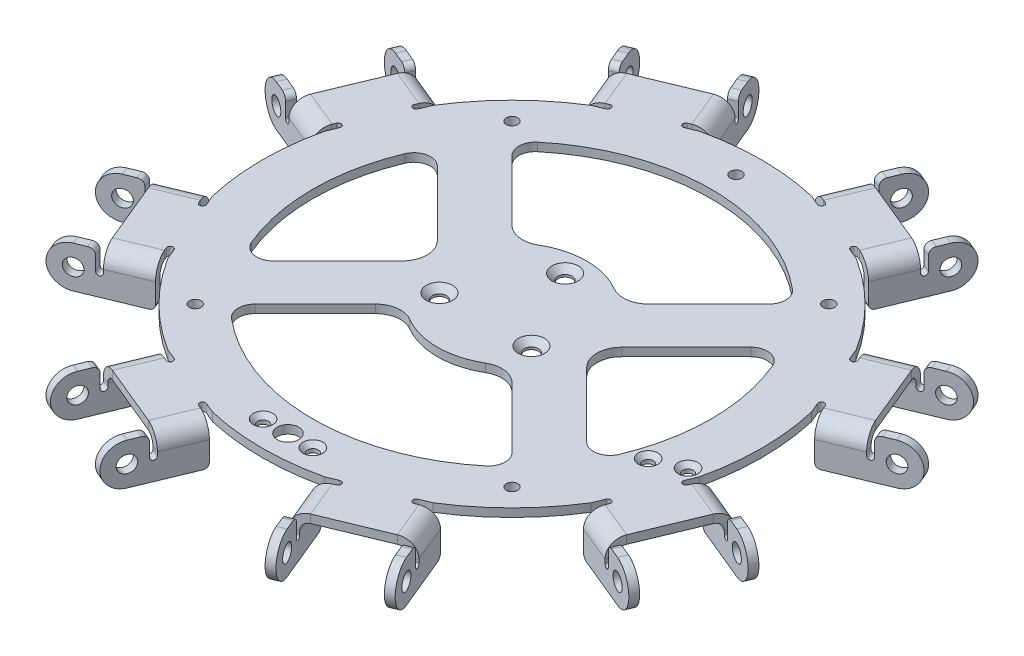
from build123d import *

# Parameters (mm, degrees)
BASIS_BLECH1_START              = -2.5
BASIS_BLECH1_DEPTH              = 2.5
KANTE_LASCHE2_START             = 76
KANTE_LASCHE2_DEPTH             = 12
KANTE_LASCHE2_START_2           = 74.18894796
KANTE_LASCHE2_2_DEPTH           = 13.81105204
KANTE_LASCHE2_START_3           = -2.5
KANTE_LASCHE2_3_DEPTH           = 2.5
VERRUNDUNG4_R                   = 1.5
SKIZZE34_R                      = 2.5
AUFSATZ_LINEAR_AUSTRAGEN2_DEPTH = 2.5
VERRUNDUNG4_OF_SPIEGELN2_R      = 1.5
KREISMUSTER5_COUNT              = 8
SKIZZE51_R                      = 2.15
ZUNGE1_DEPTH                    = 2.5
VERRUNDUNG3_R                   = 5
FASE1_SIZE                      = 1.8
SKIZZE52_R                      = 1.75
SKIZZE52_R_2                    = 3.25
SKIZZE52_R_3                    = 1.6
SCHNITT_LINEAR_AUSTRAGEN1_DEPTH = 141.962759918
FASE2_SIZE                      = 1.35


# Read off the part's stored shape, not the designer's step: Basis-Blech1, Kante-Lasche2
# Sheet-metal steps are written as plain solids
with BuildPart() as part:
    # Basis-Blech1 outline → Basis-Blech1 (new body)
    with BuildSketch(Plane(origin=(0, 0, 0), x_dir=(1, 0, 0), z_dir=(0, 1, 0)).offset(BASIS_BLECH1_START)):
        with BuildLine():
            ThreePointArc((17.535446703, 74.998387375), (18.025513853, 73.815260616), (16.842387094, 73.325193467))
            ThreePointArc((16.842387094, 73.325193467), (8.475139561, 74.755749006), (0, 75.234632982))
            Line((0, 75.234632982), (0, 60))
            ThreePointArc((0, 60), (22.961005942, 55.432771951), (42.426406871, 42.426406871))
            Line((42.426406871, 42.426406871), (53.198919162, 53.198919162))
            ThreePointArc((53.198919162, 53.198919162), (46.8674684, 58.85312571), (39.939375407, 63.758107658))
            ThreePointArc((39.939375407, 63.758107658), (39.449308257, 64.941234417), (40.632435016, 65.431301566))
            Line((40.632435016, 65.431301566), (45.224636205, 76.517855956))
            Line((45.224636205, 76.517855956), (22.127647892, 86.084941766))
            Line((22.127647892, 86.084941766), (17.535446703, 74.998387375))
        make_face()
    extrude(amount=BASIS_BLECH1_DEPTH)

    # Kante-Lasche2 outline → Kante-Lasche2 (add)
    with BuildSketch(Plane(origin=(0, 0, 0), x_dir=(0.9238795325112853, 0, 0.38268343236509317), z_dir=(0.38268343236509317, 0, -0.9238795325112854)).offset(KANTE_LASCHE2_START)):
        with BuildLine():
            Line((-15, 12.5), (-15, 5))
            ThreePointArc((-15, 5), (-14.330127019, 2.5), (-12.5, 0.669872981))
            Line((-12.5, 0.669872981), (-12.5, 2.5))
            Line((-12.5, 2.5), (-10, 2.5))
            ThreePointArc((-10, 2.5), (-11.767766953, 3.232233047), (-12.5, 5))
            Line((-12.5, 5), (-12.5, 12.5))
            Line((-12.5, 12.5), (-15, 12.5))
        make_face()
    kante_lasche2 = extrude(amount=KANTE_LASCHE2_DEPTH)

    # Kante-Lasche2 2 outline → Kante-Lasche2 2 (cut)
    with BuildSketch(Plane(origin=(0, 0, 0), x_dir=(0.9238795325112853, 0, 0.38268343236509317), z_dir=(0.38268343236509317, 0, -0.9238795325112854)).offset(KANTE_LASCHE2_START_2)):
        with BuildLine():
            ThreePointArc((-10, 0), (-11.294095226, 0.170370868), (-12.5, 0.669872981))
            Line((-12.5, 0.669872981), (-12.5, 0))
            Line((-12.5, 0), (-10, 0))
        make_face()
    kante_lasche2_2 = extrude(amount=KANTE_LASCHE2_2_DEPTH, mode=Mode.SUBTRACT)

    # Kante-Lasche2 3 outline → Kante-Lasche2 3 (cut)
    with BuildSketch(Plane(origin=(0, 0, 0), x_dir=(1, 0, 0), z_dir=(0, 1, 0)).offset(KANTE_LASCHE2_START_3)):
        with BuildLine():
            Line((20.769025067, 73.658995362), (19.845145535, 74.041678795))
            Line((19.845145535, 74.041678795), (17.535446703, 74.998387375))
            ThreePointArc((17.535446703, 74.998387375), (18.025513853, 73.815260616), (16.842387094, 73.325193467))
            Line((16.842387094, 73.325193467), (20.075965456, 71.98580145))
            ThreePointArc((20.075965456, 71.98580145), (21.259092218, 72.4758686), (20.769025067, 73.658995362))
        make_face()
    kante_lasche2_3 = extrude(amount=KANTE_LASCHE2_3_DEPTH, mode=Mode.SUBTRACT)

    # Verrundung4
    verrundung4_edges = [part.edges().sort_by_distance(p)[0] for p in [
        (16.380597288, -12.5, -75.476741666),
    ]]
    fillet(verrundung4_edges, radius=VERRUNDUNG4_R)

    # Skizze34 → Aufsatz-Linear austragen2 (add)
    with BuildSketch(Plane(origin=(-13.858192988, 0, -5.740251485), x_dir=(0.38268343236509406, -1.369350941250924e-15, -0.9238795325112851), z_dir=(0.923879532511285, -3.3059056140163063e-15, 0.382683432365094))):
        with BuildLine():
            Line((89.81105204, -5), (89.81105204, -6))
            ThreePointArc((89.81105204, -6), (88.90552602, -6.90552602), (88, -6))
            Line((88, -6), (88, -12.5))
            Line((88, -12.5), (95, -12.5))
            ThreePointArc((95, -12.5), (101.25, -6.25), (95, 0))
            Line((95, 0), (91.62105204, 0))
            ThreePointArc((91.62105204, 0), (90.341188766, -0.530136726), (89.81105204, -1.81))
            Line((89.81105204, -1.81), (89.81105204, -5))
        make_face()
        with Locations((95, -6.25)):
            Circle(SKIZZE34_R, mode=Mode.SUBTRACT)
    aufsatz_linear_austragen2 = extrude(amount=AUFSATZ_LINEAR_AUSTRAGEN2_DEPTH)

    # Spiegeln2: Kante-Lasche2, Kante-Lasche2 2, Kante-Lasche2 3, Aufsatz-Linear austragen2 across plane
    add(kante_lasche2.mirror(Plane(origin=(0, 0, 0), x_dir=(-0.38268343236509167, 0, 0.923879532511286), z_dir=(0.923879532511286, 0, 0.38268343236509167))))
    add(kante_lasche2_2.mirror(Plane(origin=(0, 0, 0), x_dir=(-0.38268343236509167, 0, 0.923879532511286), z_dir=(0.923879532511286, 0, 0.38268343236509167))), mode=Mode.SUBTRACT)
    add(kante_lasche2_3.mirror(Plane(origin=(0, 0, 0), x_dir=(-0.38268343236509167, 0, 0.923879532511286), z_dir=(0.923879532511286, 0, 0.38268343236509167))), mode=Mode.SUBTRACT)
    add(aufsatz_linear_austragen2.mirror(Plane(origin=(0, 0, 0), x_dir=(-0.38268343236509167, 0, 0.923879532511286), z_dir=(0.923879532511286, 0, 0.38268343236509167))))

    # Verrundung4 of Spiegeln2
    verrundung4_of_spiegeln2_edges = [part.edges().sort_by_distance(p)[0] for p in [
        (41.787284432, -12.5, -64.952947276),
    ]]
    fillet(verrundung4_of_spiegeln2_edges, radius=VERRUNDUNG4_OF_SPIEGELN2_R)


with BuildPart() as kreismuster5_1:
    # Kreismuster5: pattern copy
    add(part.part.rotate(Axis((0, 0, 0), (0, 1, 0)), 1 * 360 / KREISMUSTER5_COUNT))


with BuildPart() as kreismuster5_2:
    # Kreismuster5: pattern copy
    add(part.part.rotate(Axis((0, 0, 0), (0, 1, 0)), 2 * 360 / KREISMUSTER5_COUNT))


with BuildPart() as kreismuster5_3:
    # Kreismuster5: pattern copy
    add(part.part.rotate(Axis((0, 0, 0), (0, 1, 0)), 3 * 360 / KREISMUSTER5_COUNT))


with BuildPart() as kreismuster5_4:
    # Kreismuster5: pattern copy
    add(part.part.rotate(Axis((0, 0, 0), (0, 1, 0)), 4 * 360 / KREISMUSTER5_COUNT))


with BuildPart() as kreismuster5_5:
    # Kreismuster5: pattern copy
    add(part.part.rotate(Axis((0, 0, 0), (0, 1, 0)), 5 * 360 / KREISMUSTER5_COUNT))


with BuildPart() as kreismuster5_6:
    # Kreismuster5: pattern copy
    add(part.part.rotate(Axis((0, 0, 0), (0, 1, 0)), 6 * 360 / KREISMUSTER5_COUNT))


with BuildPart() as kreismuster5_7:
    # Kreismuster5: pattern copy
    add(part.part.rotate(Axis((0, 0, 0), (0, 1, 0)), 7 * 360 / KREISMUSTER5_COUNT))


with BuildPart() as kreismuster5_2_1:
    add(kreismuster5_2.part)

    # Kombinieren1: union Kreismuster5_6, Kreismuster5_1, Kreismuster5_5, Kreismuster5_4, part, Kreismuster5_3, Kreismuster5_7
    add(kreismuster5_6.part)
    add(kreismuster5_1.part)
    add(kreismuster5_5.part)
    add(kreismuster5_4.part)
    add(part.part)
    add(kreismuster5_3.part)
    add(kreismuster5_7.part)

    # Skizze51 → Zunge1 (add)
    with BuildSketch(Plane(origin=(0, 0, 0), x_dir=(1, 0, 0), z_dir=(0, 1, 0))):
        with BuildLine():
            Line((-20.539595906, 20.539595906), (-42.426406871, 42.426406871))
            ThreePointArc((-42.426406871, 42.426406871), (-47.721033909, 36.368982976), (-52.15767043, 29.65767043))
            Line((-52.15767043, 29.65767043), (-27.803300859, 5.303300859))
            ThreePointArc((-27.803300859, 5.303300859), (-25.606601718, 0), (-27.803300859, -5.303300859))
            Line((-27.803300859, -5.303300859), (-52.15767043, -29.65767043))
            ThreePointArc((-52.15767043, -29.65767043), (-47.721033909, -36.368982976), (-42.426406871, -42.426406871))
            Line((-42.426406871, -42.426406871), (-20.539595906, -20.539595906))
            ThreePointArc((-20.539595906, -20.539595906), (-16.181327241, -18.402674043), (-11.427221286, -19.382172574))
            ThreePointArc((-11.427221286, -19.382172574), (0, -22.5), (11.427221286, -19.382172574))
            ThreePointArc((11.427221286, -19.382172574), (16.181327241, -18.402674043), (20.539595906, -20.539595906))
            Line((20.539595906, -20.539595906), (42.426406871, -42.426406871))
            ThreePointArc((42.426406871, -42.426406871), (47.721033909, -36.368982976), (52.15767043, -29.65767043))
            Line((52.15767043, -29.65767043), (27.803300859, -5.303300859))
            ThreePointArc((27.803300859, -5.303300859), (25.606601718, 0), (27.803300859, 5.303300859))
            Line((27.803300859, 5.303300859), (52.15767043, 29.65767043))
            ThreePointArc((52.15767043, 29.65767043), (47.721033909, 36.368982976), (42.426406871, 42.426406871))
            Line((42.426406871, 42.426406871), (20.539595906, 20.539595906))
            ThreePointArc((20.539595906, 20.539595906), (16.181327241, 18.402674043), (11.427221286, 19.382172574))
            ThreePointArc((11.427221286, 19.382172574), (0, 22.5), (-11.427221286, 19.382172574))
            ThreePointArc((-11.427221286, 19.382172574), (-16.181327241, 18.402674043), (-20.539595906, 20.539595906))
        make_face()
        with Locations(Location((0, 16, 0), (0, 0, 270))):
            Circle(SKIZZE51_R, mode=Mode.SUBTRACT)
        with Locations(Location((13.856406461, -8, 0), (0, 0, 270))):
            Circle(SKIZZE51_R, mode=Mode.SUBTRACT)
        with Locations(Location((-13.856406461, -8, 0), (0, 0, 270))):
            Circle(SKIZZE51_R, mode=Mode.SUBTRACT)
    extrude(amount=-ZUNGE1_DEPTH)

    # Verrundung3
    verrundung3_edges = [kreismuster5_2_1.edges().sort_by_distance(p)[0] for p in [
        (-42.426406871, -1.25, 42.426406871),
        (-52.15767043, -1.25, 29.65767043),
        (-52.15767043, -1.25, -29.65767043),
        (-42.426406871, -1.25, -42.426406871),
        (42.426406871, -1.25, -42.426406871),
        (52.15767043, -1.25, -29.65767043),
        (52.15767043, -1.25, 29.65767043),
        (42.426406871, -1.25, 42.426406871),
    ]]
    fillet(verrundung3_edges, radius=VERRUNDUNG3_R)

    # Fase1
    fase1_edges = [kreismuster5_2_1.edges().sort_by_distance(p)[0] for p in [
        (0, 0, -18.15),
        (13.856406461, 0, 5.85),
        (-13.856406461, 0, 5.85),
    ]]
    chamfer(fase1_edges, length=FASE1_SIZE)

    # Skizze52 → Schnitt-Linear austragen1 (cut, through all)
    with BuildSketch(Plane(origin=(0, 0, 0), x_dir=(1, 0, 0), z_dir=(0, 1, 0))):
        with Locations(Location((-47.72970773, -47.72970773, 0), (0, 0, 270))):
            Circle(SKIZZE52_R)
        with Locations(Location((-47.72970773, 47.72970773, 0), (0, 0, 270))):
            Circle(SKIZZE52_R)
        with Locations(Location((0, 67.5, 0), (0, 0, 270))):
            Circle(SKIZZE52_R)
        with Locations(Location((47.72970773, 47.72970773, 0), (0, 0, 270))):
            Circle(SKIZZE52_R)
        with Locations(Location((47.72970773, -47.72970773, 0), (0, 0, 270))):
            Circle(SKIZZE52_R)
        with Locations(Location((0, -67.5, 0), (0, 0, 270))):
            Circle(SKIZZE52_R_2)
        with Locations(Location((7.5, -67.5, 0), (0, 0, 270))):
            Circle(SKIZZE52_R_3)
        with Locations(Location((-7.5, -67.5, 0), (0, 0, 270))):
            Circle(SKIZZE52_R_3)
        with Locations(Location((69.343622295, -16.304446714, 0), (0, 0, 270))):
            Circle(SKIZZE52_R_3)
        with Locations(Location((60.85324106, -19.821277771, 0), (0, 0, 270))):
            Circle(SKIZZE52_R_3)
    extrude(amount=-SCHNITT_LINEAR_AUSTRAGEN1_DEPTH, mode=Mode.SUBTRACT)

    # Fase2
    fase2_edges = [kreismuster5_2_1.edges().sort_by_distance(p)[0] for p in [
        (69.343622295, 0, 14.704446714),
        (-7.5, 0, 65.9),
        (7.5, 0, 65.9),
        (60.85324106, 0, 18.221277771),
    ]]
    chamfer(fase2_edges, length=FASE2_SIZE)


solid = kreismuster5_2_1.part
